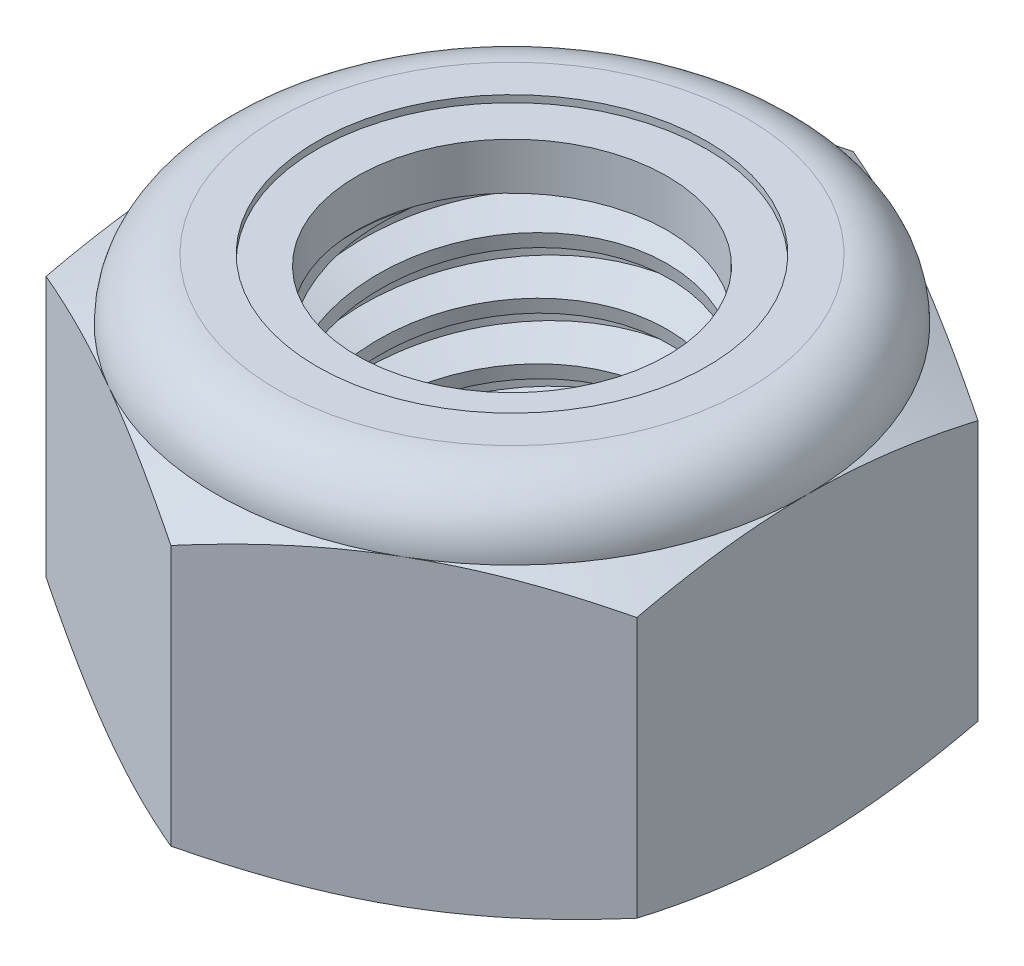
from build123d import *

# Parameters (mm, degrees)
EXTRUDE1_DEPTH       = 8
SKETCH2_W            = 4
SKETCH2_H            = 8
LPATTERN1_COUNT      = 6
LPATTERN1_PITCH      = 1.25
LPATTERN1_COUNT_DIR2 = 2
LPATTERN1_PITCH_DIR2 = 1.25


with BuildPart() as part:
    # Sketch1 → Extrude1 (new body)
    with BuildSketch(Plane(origin=(0, 0, 0), x_dir=(1, 0, 0), z_dir=(0, 1, 0))):
        Polygon((0, 7.505553499), (-6.5, 3.75277675), (-6.5, -3.75277675), (0, -7.505553499), (6.5, -3.75277675), (6.5, 3.75277675), align=None)
    extrude(amount=EXTRUDE1_DEPTH)

    # Sketch4 → Cut-Revolve2 (revolve, cut)
    with BuildSketch(Plane(origin=(0, 0, 0), x_dir=(0, 0, -1), z_dir=(1, 0, 0))):
        Polygon((0, 8), (4, 8), (3.415953356, 7.727654577), (3.415953356, 0.272345423), (4, 0), (0, 0), align=None)
    revolve(axis=Axis((0, 8, 0), (0, 1, 0)), mode=Mode.SUBTRACT)


with BuildPart() as body_2:
    # Sketch2 → Revolve1 (revolve)
    with BuildSketch(Plane(origin=(0, 0, 0), x_dir=(0, 0, -1), z_dir=(1, 0, 0))):
        with Locations((2, 4)):
            Rectangle(SKETCH2_W, SKETCH2_H)
    revolve(axis=Axis((0, -4, 0), (0, 1, 0)))

    # Sketch3 → Cut-Revolve1 (revolve, cut)
    with BuildSketch(Plane(origin=(0, 0, 0), x_dir=(0, 0, -1), z_dir=(1, 0, 0))):
        Polygon((4.024121388, 7.84562312), (4.1929711, 6.764984958), (3.464196131, 7.046478487), (3.415953356, 7.355232247), align=None)
    cut_revolve1 = revolve(axis=Axis((0, 8, 0.208852549), (0, -0.9880120337511015, -0.1543768802736098)), mode=Mode.SUBTRACT)

    # LPattern1: Cut-Revolve1 6 × 2
    with Locations(*[Vector(0, -1, 0) * (i * LPATTERN1_PITCH) + Vector(0, 1, 0) * (j * LPATTERN1_PITCH_DIR2) for i in range(LPATTERN1_COUNT) for j in range(LPATTERN1_COUNT_DIR2) if (i, j) != (0, 0)]):
        add(cut_revolve1, mode=Mode.SUBTRACT)


with BuildPart() as part_1:
    add(part.part)

    # Combine1: cut body 2
    add(body_2.part, mode=Mode.SUBTRACT)

    # Sketch5 → Cut-Revolve3 (revolve, cut)
    with BuildSketch(Plane(origin=(0, 0, 0), x_dir=(0, 0, -1), z_dir=(1, 0, 0))):
        with BuildLine():
            Line((0, 0), (6.5, 0))
            Line((6.5, 0), (7.505553499, 0.468897297))
            Line((7.505553499, 0.468897297), (7.505553499, 6.197769369))
            Line((7.505553499, 6.197769369), (6.5, 6.666666667))
            ThreePointArc((6.5, 6.666666667), (6.109475708, 7.609475708), (5.166666667, 8))
            Line((5.166666667, 8), (5.166666667, 9.27))
            Line((5.166666667, 9.27), (8.775553499, 9.27))
            Line((8.775553499, 9.27), (8.775553499, -1.27))
            Line((8.775553499, -1.27), (0, -1.27))
            Line((0, -1.27), (0, 0))
        make_face()
    revolve(axis=Axis((0, 0, 0), (0, 1, 0)), mode=Mode.SUBTRACT)

    # Sketch6 → Cut-Revolve4 (revolve, cut)
    with BuildSketch(Plane(origin=(0, 0, 0), x_dir=(0, 0, -1), z_dir=(1, 0, 0))):
        with BuildLine():
            Line((0, 6.666666667), (6.3476, 6.666666667))
            ThreePointArc((6.3476, 6.666666667), (6.001712635, 7.501712635), (5.166666667, 7.8476))
            Line((5.166666667, 7.8476), (4.291310011, 7.8476))
            Line((4.291310011, 7.8476), (4.291310011, 9.27))
            Line((4.291310011, 9.27), (0, 9.27))
            Line((0, 9.27), (0, 6.666666667))
        make_face()
    revolve(axis=Axis((0, 9.27, 0), (0, 1, 0)), mode=Mode.SUBTRACT)


with BuildPart() as body_2_2:
    # Sketch7 → Revolve2 (revolve)
    with BuildSketch(Plane(origin=(0, 0, 0), x_dir=(0, 0, -1), z_dir=(1, 0, 0))):
        with BuildLine():
            Line((3.415953356, 6.742866667), (6.268768884, 6.742866667))
            ThreePointArc((6.268768884, 6.742866667), (5.920409016, 7.474322663), (5.166666667, 7.7714))
            Line((5.166666667, 7.7714), (3.415953356, 7.7714))
            Line((3.415953356, 7.7714), (3.415953356, 6.742866667))
        make_face()
    revolve(axis=Axis((0, 6.742866667, 0), (0, 1, 0)))


solid = Compound([part_1.part, body_2_2.part])
